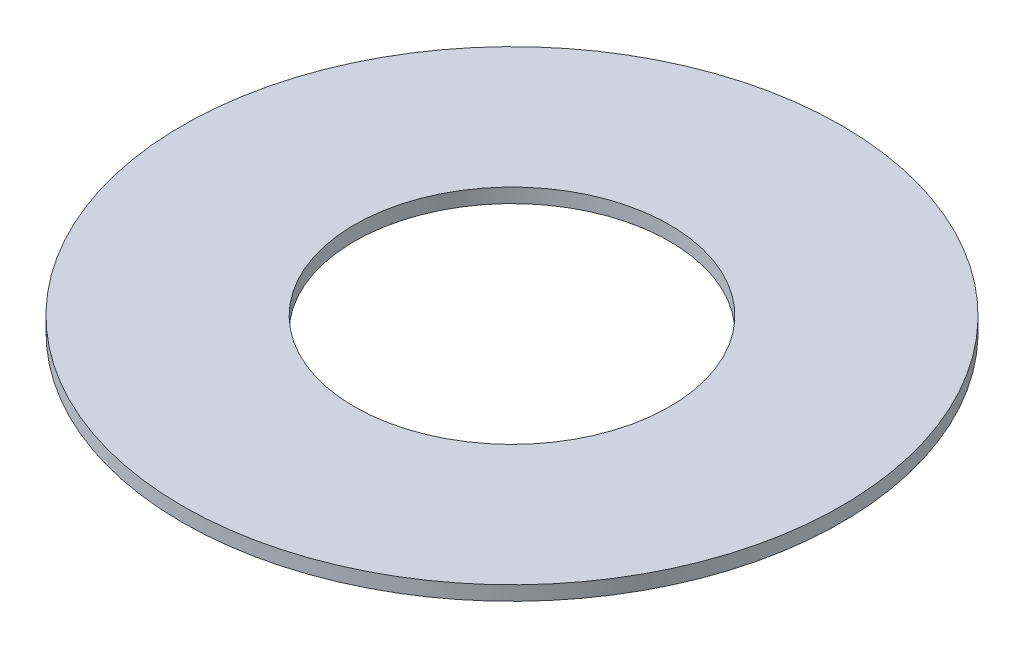
from build123d import *

# Parameters (mm, degrees)
SKETCH1_R               = 46
BOSS_EXTRUDE1_DEPTH     = 2
CUT_EXTRUDE1_DEPTH      = 66.084560381
CUT_EXTRUDE1_DEPTH_BACK = 66.084560381
SKETCH2_R               = 0.25
CUT_EXTRUDE2_DEPTH      = 66.084560381
CUT_EXTRUDE2_DEPTH_BACK = 66.084560381
SKETCH3_R               = 1
SKETCH4_R               = 1
CUT_EXTRUDE3_DEPTH      = 1
SKETCH5_R               = 22
CUT_EXTRUDE4_DEPTH      = 10


with BuildPart() as part:
    # Sketch1 → Boss-Extrude1 (new body)
    with BuildSketch(Plane(origin=(0, 0, 0), x_dir=(1, 0, 0), z_dir=(0, 1, 0))):
        Circle(SKETCH1_R)
    extrude(amount=BOSS_EXTRUDE1_DEPTH)

    # Sketch2 → Cut-Extrude1 (cut, two sides: drawn at the far end of the back side and taken through both)
    with BuildSketch(Plane(origin=(0, 2, 0), x_dir=(1, 0, 0), z_dir=(0, 1, 0)).offset(-CUT_EXTRUDE1_DEPTH_BACK)):
        with Locations((-12.5, 0)):
            Circle(SKETCH2_R)
    extrude(amount=CUT_EXTRUDE1_DEPTH + CUT_EXTRUDE1_DEPTH_BACK, mode=Mode.SUBTRACT)

    # Sketch3 → Cut-Extrude2 (cut, two sides: drawn at the far end of the back side and taken through both)
    with BuildSketch(Plane(origin=(0, 2, 0), x_dir=(1, 0, 0), z_dir=(0, 1, 0)).offset(-CUT_EXTRUDE2_DEPTH_BACK)):
        with Locations((3.105828541, -11.591109915)):
            Circle(SKETCH3_R)
    extrude(amount=CUT_EXTRUDE2_DEPTH + CUT_EXTRUDE2_DEPTH_BACK, mode=Mode.SUBTRACT)

    # Sketch4 → Cut-Extrude3 (cut)
    with BuildSketch(Plane(origin=(0, 2, 0), x_dir=(1, 0, 0), z_dir=(0, 1, 0))):
        with Locations((0, -18)):
            Circle(SKETCH4_R)
        with Locations((-16.914467174, 6.15636258)):
            Circle(SKETCH4_R)
        with Locations((16.914467174, 6.15636258)):
            Circle(SKETCH4_R)
    extrude(amount=-CUT_EXTRUDE3_DEPTH, mode=Mode.SUBTRACT)

    # Sketch5 → Cut-Extrude4 (cut)
    with BuildSketch(Plane(origin=(0, 2, 0), x_dir=(1, 0, 0), z_dir=(0, 1, 0))):
        Circle(SKETCH5_R)
    extrude(amount=-CUT_EXTRUDE4_DEPTH, mode=Mode.SUBTRACT)


solid = part.part
